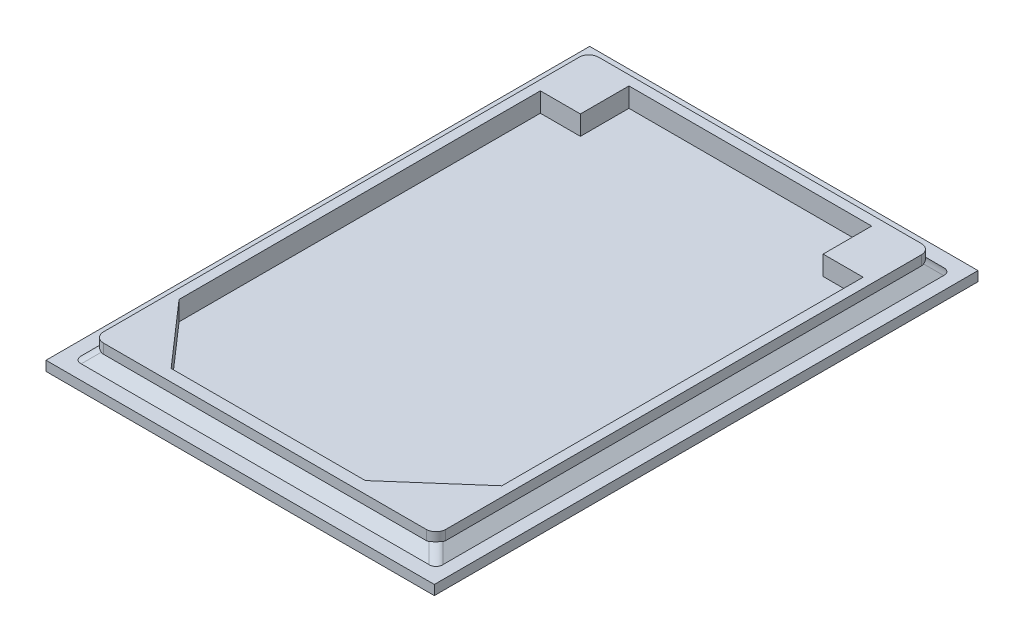
from build123d import *

# Parameters (mm, degrees)
SKETCH_1_W      = 40
SKETCH_1_H      = 56
EXTRUDE_1_DEPTH = 1
SKETCH_2_W      = 35.25
SKETCH_2_H      = 51
EXTRUDE_2_DEPTH = 2
CHAMFER_1_SIZE  = 1
FILLET_1_R      = 1


with BuildPart() as part:
    # Эскиз1 → Бобышка-Вытянуть1 (new body)
    with BuildSketch(Plane(origin=(0, 0, 0), x_dir=(1, 0, 0), z_dir=(0, 1, 0))):
        with Locations((4.960996663, -13.297915159)):
            Rectangle(SKETCH_1_W, SKETCH_1_H)
    extrude(amount=EXTRUDE_1_DEPTH)

    # Эскиз2 → Бобышка-Вытянуть2 (add)
    with BuildSketch(Plane(origin=(0, 1, 0), x_dir=(1, 0, 0), z_dir=(0, 1, 0))):
        with Locations((5.013351172, -13.304787139)):
            Rectangle(SKETCH_2_W, SKETCH_2_H)
        Polygon((-7.486648828, 11.195212861), (17.513351172, 11.195212861), (17.513351172, 6.195212861), (21.638351172, 6.195212861), (21.638351172, -31.019787139), (14.138351172, -37.586749907), (-5.861648828, -37.586749907), (-11.611648828, -31.019787139), (-11.611648828, 6.195212861), (-7.486648828, 6.195212861), align=None, mode=Mode.SUBTRACT)
    extrude(amount=EXTRUDE_2_DEPTH)

    # Фаска1
    chamfer_1_edges = [part.edges().sort_by_distance(p)[0] for p in [
        (-12.611648828, 1, 13.304787139),
        (5.013351172, 1, 38.804787139),
        (22.638351172, 1, 13.304787139),
        (5.013351172, 1, -12.195212861),
    ]]
    chamfer(chamfer_1_edges, length=CHAMFER_1_SIZE)

    # Скругление1
    # the kernel refuses this fillet: 1 mm, written as the material it takes off along each edge
    with BuildSketch(Plane(origin=(-12.611648828, -0.5, -12.195212861), x_dir=(0, 0, 1), z_dir=(0, 1, 0))) as fillet_1_piece_1_section:
        with BuildLine():
            CenterArc((FILLET_1_R, FILLET_1_R), FILLET_1_R, 180, 90)
            Line((0, FILLET_1_R), (0, 0))
            Line((0, 0), (FILLET_1_R, 0))
        make_face()
    fillet_1_piece_1 = extrude(amount=6, mode=Mode.PRIVATE)
    fillet_1_piece_1 = split(fillet_1_piece_1, bisect_by=Plane(origin=(-12.204207693, 2.407441135, -12.152230903), z_dir=(0.7071067811865476, -0.7071067811865476, 0)), keep=Keep.TOP, mode=Mode.PRIVATE)
    fillet_1_piece_1 = split(fillet_1_piece_1, bisect_by=Plane(origin=(-12.0827213, 2.16446835, -12.030744511), z_dir=(0, 0.7071067811865476, -0.7071067811865476)), keep=Keep.TOP, mode=Mode.PRIVATE)
    add(fillet_1_piece_1, mode=Mode.SUBTRACT)
    with BuildSketch(Plane(origin=(-12.611648828, -0.5, -12.195212861), x_dir=(0, 0, 1), z_dir=(0, 1, 0))) as fillet_1_piece_2_section:
        with BuildLine():
            CenterArc((FILLET_1_R, FILLET_1_R), FILLET_1_R, 180, 90)
            Line((0, FILLET_1_R), (0, 0))
            Line((0, 0), (FILLET_1_R, 0))
        make_face()
    fillet_1_piece_2 = extrude(amount=6, mode=Mode.PRIVATE)
    fillet_1_piece_2 = split(fillet_1_piece_2, bisect_by=Plane(origin=(-12.447180477, 2.16446835, -11.666285334), z_dir=(-0.7071067811865476, 0.7071067811865476, 0)), keep=Keep.TOP, mode=Mode.PRIVATE)
    fillet_1_piece_2 = split(fillet_1_piece_2, bisect_by=Plane(origin=(-12.56866687, 2.407441135, -11.787771726), z_dir=(0, -0.7071067811865476, 0.7071067811865476)), keep=Keep.TOP, mode=Mode.PRIVATE)
    add(fillet_1_piece_2, mode=Mode.SUBTRACT)
    with BuildSketch(Plane(origin=(-12.611648828, -0.5, -12.195212861), x_dir=(0, 0, 1), z_dir=(0, 1, 0))) as fillet_1_piece_3_section:
        with BuildLine():
            CenterArc((FILLET_1_R, FILLET_1_R), FILLET_1_R, 180, 90)
            Line((0, FILLET_1_R), (0, 0))
            Line((0, 0), (FILLET_1_R, 0))
        make_face()
    fillet_1_piece_3 = extrude(amount=6, mode=Mode.PRIVATE)
    fillet_1_piece_3 = split(fillet_1_piece_3, bisect_by=Plane(origin=(-11.535111432, 3.076537395, -11.974767382), z_dir=(-0.7071067811865476, 0.7071067811865476, 0)), keep=Keep.TOP, mode=Mode.PRIVATE)
    fillet_1_piece_3 = split(fillet_1_piece_3, bisect_by=Plane(origin=(-12.391203349, 3.076537395, -11.118675466), z_dir=(0, 0.7071067811865476, -0.7071067811865476)), keep=Keep.TOP, mode=Mode.PRIVATE)
    add(fillet_1_piece_3, mode=Mode.SUBTRACT)
    with BuildSketch(Plane(origin=(-12.611648828, -0.5, 38.804787139), x_dir=(0, 0, -1), z_dir=(0, 1, 0))) as fillet_1_piece_4_section:
        with BuildLine():
            CenterArc((FILLET_1_R, -FILLET_1_R), FILLET_1_R, 90, 90)
            Line((0, -FILLET_1_R), (0, 0))
            Line((0, 0), (FILLET_1_R, 0))
        make_face()
    fillet_1_piece_4 = extrude(amount=6, mode=Mode.PRIVATE)
    fillet_1_piece_4 = split(fillet_1_piece_4, bisect_by=Plane(origin=(-12.204207693, 2.407441135, 38.761805181), z_dir=(0.7071067811865476, -0.7071067811865476, 0)), keep=Keep.TOP, mode=Mode.PRIVATE)
    fillet_1_piece_4 = split(fillet_1_piece_4, bisect_by=Plane(origin=(-12.0827213, 2.16446835, 38.640318789), z_dir=(0, 0.7071067811865476, 0.7071067811865476)), keep=Keep.TOP, mode=Mode.PRIVATE)
    add(fillet_1_piece_4, mode=Mode.SUBTRACT)
    with BuildSketch(Plane(origin=(-12.611648828, -0.5, 38.804787139), x_dir=(0, 0, -1), z_dir=(0, 1, 0))) as fillet_1_piece_5_section:
        with BuildLine():
            CenterArc((FILLET_1_R, -FILLET_1_R), FILLET_1_R, 90, 90)
            Line((0, -FILLET_1_R), (0, 0))
            Line((0, 0), (FILLET_1_R, 0))
        make_face()
    fillet_1_piece_5 = extrude(amount=6, mode=Mode.PRIVATE)
    fillet_1_piece_5 = split(fillet_1_piece_5, bisect_by=Plane(origin=(-12.447180477, 2.16446835, 38.275859612), z_dir=(-0.7071067811865476, 0.7071067811865476, 0)), keep=Keep.TOP, mode=Mode.PRIVATE)
    fillet_1_piece_5 = split(fillet_1_piece_5, bisect_by=Plane(origin=(-12.56866687, 2.407441135, 38.397346004), z_dir=(0, -0.7071067811865476, -0.7071067811865476)), keep=Keep.TOP, mode=Mode.PRIVATE)
    add(fillet_1_piece_5, mode=Mode.SUBTRACT)
    with BuildSketch(Plane(origin=(-12.611648828, -0.5, 38.804787139), x_dir=(0, 0, -1), z_dir=(0, 1, 0))) as fillet_1_piece_6_section:
        with BuildLine():
            CenterArc((FILLET_1_R, -FILLET_1_R), FILLET_1_R, 90, 90)
            Line((0, -FILLET_1_R), (0, 0))
            Line((0, 0), (FILLET_1_R, 0))
        make_face()
    fillet_1_piece_6 = extrude(amount=6, mode=Mode.PRIVATE)
    fillet_1_piece_6 = split(fillet_1_piece_6, bisect_by=Plane(origin=(-11.535111432, 3.076537395, 38.58434166), z_dir=(-0.7071067811865476, 0.7071067811865476, 0)), keep=Keep.TOP, mode=Mode.PRIVATE)
    fillet_1_piece_6 = split(fillet_1_piece_6, bisect_by=Plane(origin=(-12.391203349, 3.076537395, 37.728249744), z_dir=(0, 0.7071067811865476, 0.7071067811865476)), keep=Keep.TOP, mode=Mode.PRIVATE)
    add(fillet_1_piece_6, mode=Mode.SUBTRACT)
    with BuildSketch(Plane(origin=(22.638351172, -0.5, 38.804787139), x_dir=(-1, 0, 0), z_dir=(0, 1, 0))) as fillet_1_piece_7_section:
        with BuildLine():
            CenterArc((FILLET_1_R, -FILLET_1_R), FILLET_1_R, 90, 90)
            Line((0, -FILLET_1_R), (0, 0))
            Line((0, 0), (FILLET_1_R, 0))
        make_face()
    fillet_1_piece_7 = extrude(amount=6, mode=Mode.PRIVATE)
    fillet_1_piece_7 = split(fillet_1_piece_7, bisect_by=Plane(origin=(22.595369214, 2.407441135, 38.397346004), z_dir=(0, -0.7071067811865476, -0.7071067811865476)), keep=Keep.TOP, mode=Mode.PRIVATE)
    fillet_1_piece_7 = split(fillet_1_piece_7, bisect_by=Plane(origin=(22.473882822, 2.16446835, 38.275859612), z_dir=(0.7071067811865476, 0.7071067811865476, 0)), keep=Keep.TOP, mode=Mode.PRIVATE)
    add(fillet_1_piece_7, mode=Mode.SUBTRACT)
    with BuildSketch(Plane(origin=(22.638351172, -0.5, 38.804787139), x_dir=(-1, 0, 0), z_dir=(0, 1, 0))) as fillet_1_piece_8_section:
        with BuildLine():
            CenterArc((FILLET_1_R, -FILLET_1_R), FILLET_1_R, 90, 90)
            Line((0, -FILLET_1_R), (0, 0))
            Line((0, 0), (FILLET_1_R, 0))
        make_face()
    fillet_1_piece_8 = extrude(amount=6, mode=Mode.PRIVATE)
    fillet_1_piece_8 = split(fillet_1_piece_8, bisect_by=Plane(origin=(22.109423645, 2.16446835, 38.640318789), z_dir=(0, 0.7071067811865476, 0.7071067811865476)), keep=Keep.TOP, mode=Mode.PRIVATE)
    fillet_1_piece_8 = split(fillet_1_piece_8, bisect_by=Plane(origin=(22.230910038, 2.407441135, 38.761805181), z_dir=(-0.7071067811865476, -0.7071067811865476, 0)), keep=Keep.TOP, mode=Mode.PRIVATE)
    add(fillet_1_piece_8, mode=Mode.SUBTRACT)
    with BuildSketch(Plane(origin=(22.638351172, -0.5, 38.804787139), x_dir=(-1, 0, 0), z_dir=(0, 1, 0))) as fillet_1_piece_9_section:
        with BuildLine():
            CenterArc((FILLET_1_R, -FILLET_1_R), FILLET_1_R, 90, 90)
            Line((0, -FILLET_1_R), (0, 0))
            Line((0, 0), (FILLET_1_R, 0))
        make_face()
    fillet_1_piece_9 = extrude(amount=6, mode=Mode.PRIVATE)
    fillet_1_piece_9 = split(fillet_1_piece_9, bisect_by=Plane(origin=(22.417905694, 3.076537395, 37.728249744), z_dir=(0, 0.7071067811865476, 0.7071067811865476)), keep=Keep.TOP, mode=Mode.PRIVATE)
    fillet_1_piece_9 = split(fillet_1_piece_9, bisect_by=Plane(origin=(21.561813777, 3.076537395, 38.58434166), z_dir=(0.7071067811865476, 0.7071067811865476, 0)), keep=Keep.TOP, mode=Mode.PRIVATE)
    add(fillet_1_piece_9, mode=Mode.SUBTRACT)
    with BuildSketch(Plane(origin=(22.638351172, -0.5, -12.195212861), x_dir=(-1, 0, 0), z_dir=(0, 1, 0))) as fillet_1_piece_10_section:
        with BuildLine():
            CenterArc((FILLET_1_R, FILLET_1_R), FILLET_1_R, 180, 90)
            Line((0, FILLET_1_R), (0, 0))
            Line((0, 0), (FILLET_1_R, 0))
        make_face()
    fillet_1_piece_10 = extrude(amount=6, mode=Mode.PRIVATE)
    fillet_1_piece_10 = split(fillet_1_piece_10, bisect_by=Plane(origin=(22.595369214, 2.407441135, -11.787771726), z_dir=(0, -0.7071067811865476, 0.7071067811865476)), keep=Keep.TOP, mode=Mode.PRIVATE)
    fillet_1_piece_10 = split(fillet_1_piece_10, bisect_by=Plane(origin=(22.473882822, 2.16446835, -11.666285334), z_dir=(0.7071067811865476, 0.7071067811865476, 0)), keep=Keep.TOP, mode=Mode.PRIVATE)
    add(fillet_1_piece_10, mode=Mode.SUBTRACT)
    with BuildSketch(Plane(origin=(22.638351172, -0.5, -12.195212861), x_dir=(-1, 0, 0), z_dir=(0, 1, 0))) as fillet_1_piece_11_section:
        with BuildLine():
            CenterArc((FILLET_1_R, FILLET_1_R), FILLET_1_R, 180, 90)
            Line((0, FILLET_1_R), (0, 0))
            Line((0, 0), (FILLET_1_R, 0))
        make_face()
    fillet_1_piece_11 = extrude(amount=6, mode=Mode.PRIVATE)
    fillet_1_piece_11 = split(fillet_1_piece_11, bisect_by=Plane(origin=(22.109423645, 2.16446835, -12.030744511), z_dir=(0, 0.7071067811865476, -0.7071067811865476)), keep=Keep.TOP, mode=Mode.PRIVATE)
    fillet_1_piece_11 = split(fillet_1_piece_11, bisect_by=Plane(origin=(22.230910038, 2.407441135, -12.152230903), z_dir=(-0.7071067811865476, -0.7071067811865476, 0)), keep=Keep.TOP, mode=Mode.PRIVATE)
    add(fillet_1_piece_11, mode=Mode.SUBTRACT)
    with BuildSketch(Plane(origin=(22.638351172, -0.5, -12.195212861), x_dir=(-1, 0, 0), z_dir=(0, 1, 0))) as fillet_1_piece_12_section:
        with BuildLine():
            CenterArc((FILLET_1_R, FILLET_1_R), FILLET_1_R, 180, 90)
            Line((0, FILLET_1_R), (0, 0))
            Line((0, 0), (FILLET_1_R, 0))
        make_face()
    fillet_1_piece_12 = extrude(amount=6, mode=Mode.PRIVATE)
    fillet_1_piece_12 = split(fillet_1_piece_12, bisect_by=Plane(origin=(22.417905694, 3.076537395, -11.118675466), z_dir=(0, 0.7071067811865476, -0.7071067811865476)), keep=Keep.TOP, mode=Mode.PRIVATE)
    fillet_1_piece_12 = split(fillet_1_piece_12, bisect_by=Plane(origin=(21.561813777, 3.076537395, -11.974767382), z_dir=(0.7071067811865476, 0.7071067811865476, 0)), keep=Keep.TOP, mode=Mode.PRIVATE)
    add(fillet_1_piece_12, mode=Mode.SUBTRACT)
    with BuildSketch(Plane(origin=(24.471684506, 0.166666667, -14.028546194), x_dir=(-0.816496580927726, -0.4082482904638632, -0.40824829046386296), z_dir=(-0.5773502691896258, 0.5773502691896258, 0.5773502691896258))) as fillet_1_piece_13_section:
        with BuildLine():
            CenterArc((FILLET_1_R * 0.57735026919, FILLET_1_R), FILLET_1_R, 210, 60)
            Line((-FILLET_1_R * 0.288675134595, FILLET_1_R * 0.5), (0, 0))
            Line((0, 0), (FILLET_1_R * 0.57735026919, 0))
        make_face()
    fillet_1_piece_13 = extrude(amount=4.618802154, mode=Mode.PRIVATE)
    fillet_1_piece_13 = split(fillet_1_piece_13, bisect_by=Plane(origin=(23.11868341, 1, -12.675545099), z_dir=(0, 1, 0)), keep=Keep.TOP, mode=Mode.PRIVATE)
    fillet_1_piece_13 = split(fillet_1_piece_13, bisect_by=Plane(origin=(23.11868341, 1.382025047, -12.195212861), z_dir=(0, 0, -1)), keep=Keep.TOP, mode=Mode.PRIVATE)
    fillet_1_piece_13 = split(fillet_1_piece_13, bisect_by=Plane(origin=(22.638351172, 1.382025047, -12.675545099), z_dir=(1, 0, 0)), keep=Keep.TOP, mode=Mode.PRIVATE)
    add(fillet_1_piece_13, mode=Mode.SUBTRACT)
    with BuildSketch(Plane(origin=(24.471684506, 0.166666667, -14.028546194), x_dir=(-0.816496580927726, -0.4082482904638632, -0.40824829046386296), z_dir=(-0.5773502691896258, 0.5773502691896258, 0.5773502691896258))) as fillet_1_piece_14_section:
        with BuildLine():
            CenterArc((FILLET_1_R * 0.57735026919, FILLET_1_R), FILLET_1_R, 210, 60)
            Line((-FILLET_1_R * 0.288675134595, FILLET_1_R * 0.5), (0, 0))
            Line((0, 0), (FILLET_1_R * 0.57735026919, 0))
        make_face()
    fillet_1_piece_14 = extrude(amount=4.618802154, mode=Mode.PRIVATE)
    fillet_1_piece_14 = split(fillet_1_piece_14, bisect_by=Plane(origin=(22.825799609, 1.79813974, -12.195212861), z_dir=(0, 0, 1)), keep=Keep.TOP, mode=Mode.PRIVATE)
    fillet_1_piece_14 = split(fillet_1_piece_14, bisect_by=Plane(origin=(22.638351172, 1.79813974, -12.007764424), z_dir=(1, 0, 0)), keep=Keep.TOP, mode=Mode.PRIVATE)
    add(fillet_1_piece_14, mode=Mode.SUBTRACT)
    with BuildSketch(Plane(origin=(24.471684506, 0.166666667, -14.028546194), x_dir=(-0.816496580927726, -0.4082482904638632, -0.40824829046386296), z_dir=(-0.5773502691896258, 0.5773502691896258, 0.5773502691896258))) as fillet_1_piece_15_section:
        with BuildLine():
            CenterArc((FILLET_1_R * 0.57735026919, FILLET_1_R), FILLET_1_R, 210, 60)
            Line((-FILLET_1_R * 0.288675134595, FILLET_1_R * 0.5), (0, 0))
            Line((0, 0), (FILLET_1_R * 0.57735026919, 0))
        make_face()
    fillet_1_piece_15 = extrude(amount=4.618802154, mode=Mode.PRIVATE)
    fillet_1_piece_15 = split(fillet_1_piece_15, bisect_by=Plane(origin=(22.450902736, 1.79813974, -12.195212861), z_dir=(0, 0, -1)), keep=Keep.TOP, mode=Mode.PRIVATE)
    fillet_1_piece_15 = split(fillet_1_piece_15, bisect_by=Plane(origin=(22.638351172, 1.79813974, -12.382661298), z_dir=(-1, 0, 0)), keep=Keep.TOP, mode=Mode.PRIVATE)
    add(fillet_1_piece_15, mode=Mode.SUBTRACT)
    with BuildSketch(Plane(origin=(24.471684506, 0.166666667, 40.638120472), x_dir=(-0.816496580927726, -0.40824829046385686, 0.4082482904638692), z_dir=(-0.5773502691896258, 0.5773502691896258, -0.5773502691896258))) as fillet_1_piece_16_section:
        with BuildLine():
            CenterArc((FILLET_1_R * 0.57735026919, -FILLET_1_R), FILLET_1_R, 90, 60)
            Line((-FILLET_1_R * 0.288675134595, -FILLET_1_R * 0.5), (0, 0))
            Line((0, 0), (FILLET_1_R * 0.57735026919, 0))
        make_face()
    fillet_1_piece_16 = extrude(amount=4.618802154, mode=Mode.PRIVATE)
    fillet_1_piece_16 = split(fillet_1_piece_16, bisect_by=Plane(origin=(23.11868341, 1, 39.285119377), z_dir=(0, 1, 0)), keep=Keep.TOP, mode=Mode.PRIVATE)
    fillet_1_piece_16 = split(fillet_1_piece_16, bisect_by=Plane(origin=(23.11868341, 1.382025047, 38.804787139), z_dir=(0, 0, 1)), keep=Keep.TOP, mode=Mode.PRIVATE)
    fillet_1_piece_16 = split(fillet_1_piece_16, bisect_by=Plane(origin=(22.638351172, 1.382025047, 39.285119377), z_dir=(1, 0, 0)), keep=Keep.TOP, mode=Mode.PRIVATE)
    add(fillet_1_piece_16, mode=Mode.SUBTRACT)
    with BuildSketch(Plane(origin=(24.471684506, 0.166666667, 40.638120472), x_dir=(-0.816496580927726, -0.40824829046385686, 0.4082482904638692), z_dir=(-0.5773502691896258, 0.5773502691896258, -0.5773502691896258))) as fillet_1_piece_17_section:
        with BuildLine():
            CenterArc((FILLET_1_R * 0.57735026919, -FILLET_1_R), FILLET_1_R, 90, 60)
            Line((-FILLET_1_R * 0.288675134595, -FILLET_1_R * 0.5), (0, 0))
            Line((0, 0), (FILLET_1_R * 0.57735026919, 0))
        make_face()
    fillet_1_piece_17 = extrude(amount=4.618802154, mode=Mode.PRIVATE)
    fillet_1_piece_17 = split(fillet_1_piece_17, bisect_by=Plane(origin=(22.825799609, 1.79813974, 38.804787139), z_dir=(0, 0, -1)), keep=Keep.TOP, mode=Mode.PRIVATE)
    fillet_1_piece_17 = split(fillet_1_piece_17, bisect_by=Plane(origin=(22.638351172, 1.79813974, 38.617338702), z_dir=(1, 0, 0)), keep=Keep.TOP, mode=Mode.PRIVATE)
    add(fillet_1_piece_17, mode=Mode.SUBTRACT)
    with BuildSketch(Plane(origin=(24.471684506, 0.166666667, 40.638120472), x_dir=(-0.816496580927726, -0.40824829046385686, 0.4082482904638692), z_dir=(-0.5773502691896258, 0.5773502691896258, -0.5773502691896258))) as fillet_1_piece_18_section:
        with BuildLine():
            CenterArc((FILLET_1_R * 0.57735026919, -FILLET_1_R), FILLET_1_R, 90, 60)
            Line((-FILLET_1_R * 0.288675134595, -FILLET_1_R * 0.5), (0, 0))
            Line((0, 0), (FILLET_1_R * 0.57735026919, 0))
        make_face()
    fillet_1_piece_18 = extrude(amount=4.618802154, mode=Mode.PRIVATE)
    fillet_1_piece_18 = split(fillet_1_piece_18, bisect_by=Plane(origin=(22.450902736, 1.79813974, 38.804787139), z_dir=(0, 0, 1)), keep=Keep.TOP, mode=Mode.PRIVATE)
    fillet_1_piece_18 = split(fillet_1_piece_18, bisect_by=Plane(origin=(22.638351172, 1.79813974, 38.992235576), z_dir=(-1, 0, 0)), keep=Keep.TOP, mode=Mode.PRIVATE)
    add(fillet_1_piece_18, mode=Mode.SUBTRACT)
    with BuildSketch(Plane(origin=(-14.444982161, 0.166666667, -14.028546194), x_dir=(-0.40824829046386274, -0.40824829046386335, 0.8164965809277261), z_dir=(0.5773502691896258, 0.5773502691896258, 0.5773502691896258))) as fillet_1_piece_19_section:
        with BuildLine():
            CenterArc((FILLET_1_R * 0.57735026919, FILLET_1_R), FILLET_1_R, 210, 60)
            Line((-FILLET_1_R * 0.288675134595, FILLET_1_R * 0.5), (0, 0))
            Line((0, 0), (FILLET_1_R * 0.57735026919, 0))
        make_face()
    fillet_1_piece_19 = extrude(amount=4.618802154, mode=Mode.PRIVATE)
    fillet_1_piece_19 = split(fillet_1_piece_19, bisect_by=Plane(origin=(-13.091981065, 1, -12.675545099), z_dir=(0, 1, 0)), keep=Keep.TOP, mode=Mode.PRIVATE)
    fillet_1_piece_19 = split(fillet_1_piece_19, bisect_by=Plane(origin=(-12.611648828, 1.382025047, -12.675545099), z_dir=(-1, 0, 0)), keep=Keep.TOP, mode=Mode.PRIVATE)
    fillet_1_piece_19 = split(fillet_1_piece_19, bisect_by=Plane(origin=(-13.091981065, 1.382025047, -12.195212861), z_dir=(0, 0, -1)), keep=Keep.TOP, mode=Mode.PRIVATE)
    add(fillet_1_piece_19, mode=Mode.SUBTRACT)
    with BuildSketch(Plane(origin=(-14.444982161, 0.166666667, -14.028546194), x_dir=(-0.40824829046386274, -0.40824829046386335, 0.8164965809277261), z_dir=(0.5773502691896258, 0.5773502691896258, 0.5773502691896258))) as fillet_1_piece_20_section:
        with BuildLine():
            CenterArc((FILLET_1_R * 0.57735026919, FILLET_1_R), FILLET_1_R, 210, 60)
            Line((-FILLET_1_R * 0.288675134595, FILLET_1_R * 0.5), (0, 0))
            Line((0, 0), (FILLET_1_R * 0.57735026919, 0))
        make_face()
    fillet_1_piece_20 = extrude(amount=4.618802154, mode=Mode.PRIVATE)
    fillet_1_piece_20 = split(fillet_1_piece_20, bisect_by=Plane(origin=(-12.611648828, 1.79813974, -12.382661298), z_dir=(1, 0, 0)), keep=Keep.TOP, mode=Mode.PRIVATE)
    fillet_1_piece_20 = split(fillet_1_piece_20, bisect_by=Plane(origin=(-12.424200391, 1.79813974, -12.195212861), z_dir=(0, 0, -1)), keep=Keep.TOP, mode=Mode.PRIVATE)
    add(fillet_1_piece_20, mode=Mode.SUBTRACT)
    with BuildSketch(Plane(origin=(-14.444982161, 0.166666667, -14.028546194), x_dir=(-0.40824829046386274, -0.40824829046386335, 0.8164965809277261), z_dir=(0.5773502691896258, 0.5773502691896258, 0.5773502691896258))) as fillet_1_piece_21_section:
        with BuildLine():
            CenterArc((FILLET_1_R * 0.57735026919, FILLET_1_R), FILLET_1_R, 210, 60)
            Line((-FILLET_1_R * 0.288675134595, FILLET_1_R * 0.5), (0, 0))
            Line((0, 0), (FILLET_1_R * 0.57735026919, 0))
        make_face()
    fillet_1_piece_21 = extrude(amount=4.618802154, mode=Mode.PRIVATE)
    fillet_1_piece_21 = split(fillet_1_piece_21, bisect_by=Plane(origin=(-12.611648828, 1.79813974, -12.007764424), z_dir=(-1, 0, 0)), keep=Keep.TOP, mode=Mode.PRIVATE)
    fillet_1_piece_21 = split(fillet_1_piece_21, bisect_by=Plane(origin=(-12.799097264, 1.79813974, -12.195212861), z_dir=(0, 0, 1)), keep=Keep.TOP, mode=Mode.PRIVATE)
    add(fillet_1_piece_21, mode=Mode.SUBTRACT)
    with BuildSketch(Plane(origin=(-14.444982161, 0.166666667, 40.638120472), x_dir=(-0.4082482904638619, -0.408248290463864, -0.816496580927726), z_dir=(0.5773502691896258, 0.5773502691896258, -0.5773502691896258))) as fillet_1_piece_22_section:
        with BuildLine():
            CenterArc((FILLET_1_R * 0.57735026919, -FILLET_1_R), FILLET_1_R, 90, 60)
            Line((-FILLET_1_R * 0.288675134595, -FILLET_1_R * 0.5), (0, 0))
            Line((0, 0), (FILLET_1_R * 0.57735026919, 0))
        make_face()
    fillet_1_piece_22 = extrude(amount=4.618802154, mode=Mode.PRIVATE)
    fillet_1_piece_22 = split(fillet_1_piece_22, bisect_by=Plane(origin=(-13.091981065, 1, 39.285119377), z_dir=(0, 1, 0)), keep=Keep.TOP, mode=Mode.PRIVATE)
    fillet_1_piece_22 = split(fillet_1_piece_22, bisect_by=Plane(origin=(-12.611648828, 1.382025047, 39.285119377), z_dir=(-1, 0, 0)), keep=Keep.TOP, mode=Mode.PRIVATE)
    fillet_1_piece_22 = split(fillet_1_piece_22, bisect_by=Plane(origin=(-13.091981065, 1.382025047, 38.804787139), z_dir=(0, 0, 1)), keep=Keep.TOP, mode=Mode.PRIVATE)
    add(fillet_1_piece_22, mode=Mode.SUBTRACT)
    with BuildSketch(Plane(origin=(-14.444982161, 0.166666667, 40.638120472), x_dir=(-0.4082482904638619, -0.408248290463864, -0.816496580927726), z_dir=(0.5773502691896258, 0.5773502691896258, -0.5773502691896258))) as fillet_1_piece_23_section:
        with BuildLine():
            CenterArc((FILLET_1_R * 0.57735026919, -FILLET_1_R), FILLET_1_R, 90, 60)
            Line((-FILLET_1_R * 0.288675134595, -FILLET_1_R * 0.5), (0, 0))
            Line((0, 0), (FILLET_1_R * 0.57735026919, 0))
        make_face()
    fillet_1_piece_23 = extrude(amount=4.618802154, mode=Mode.PRIVATE)
    fillet_1_piece_23 = split(fillet_1_piece_23, bisect_by=Plane(origin=(-12.611648828, 1.79813974, 38.992235576), z_dir=(1, 0, 0)), keep=Keep.TOP, mode=Mode.PRIVATE)
    fillet_1_piece_23 = split(fillet_1_piece_23, bisect_by=Plane(origin=(-12.424200391, 1.79813974, 38.804787139), z_dir=(0, 0, 1)), keep=Keep.TOP, mode=Mode.PRIVATE)
    add(fillet_1_piece_23, mode=Mode.SUBTRACT)
    with BuildSketch(Plane(origin=(-14.444982161, 0.166666667, 40.638120472), x_dir=(-0.4082482904638619, -0.408248290463864, -0.816496580927726), z_dir=(0.5773502691896258, 0.5773502691896258, -0.5773502691896258))) as fillet_1_piece_24_section:
        with BuildLine():
            CenterArc((FILLET_1_R * 0.57735026919, -FILLET_1_R), FILLET_1_R, 90, 60)
            Line((-FILLET_1_R * 0.288675134595, -FILLET_1_R * 0.5), (0, 0))
            Line((0, 0), (FILLET_1_R * 0.57735026919, 0))
        make_face()
    fillet_1_piece_24 = extrude(amount=4.618802154, mode=Mode.PRIVATE)
    fillet_1_piece_24 = split(fillet_1_piece_24, bisect_by=Plane(origin=(-12.611648828, 1.79813974, 38.617338702), z_dir=(-1, 0, 0)), keep=Keep.TOP, mode=Mode.PRIVATE)
    fillet_1_piece_24 = split(fillet_1_piece_24, bisect_by=Plane(origin=(-12.799097264, 1.79813974, 38.804787139), z_dir=(0, 0, -1)), keep=Keep.TOP, mode=Mode.PRIVATE)
    add(fillet_1_piece_24, mode=Mode.SUBTRACT)
    with BuildSketch(Plane(origin=(-14.444982161, 0.166666667, -14.028546194), x_dir=(-0.40824829046386274, -0.40824829046386335, 0.8164965809277261), z_dir=(0.5773502691896258, 0.5773502691896258, 0.5773502691896258))) as fillet_1_piece_25a_section:
        with BuildLine():
            CenterArc((FILLET_1_R * 0.57735026919, FILLET_1_R), FILLET_1_R, 210, 60)
            Line((-FILLET_1_R * 0.288675134595, FILLET_1_R * 0.5), (0, 0))
            Line((0, 0), (FILLET_1_R * 0.57735026919, 0))
        make_face()
    fillet_1_piece_25a = extrude(amount=4.618802154, mode=Mode.PRIVATE)
    fillet_1_piece_25a = split(fillet_1_piece_25a, bisect_by=Plane(origin=(-12.611648828, 2.347749558, -11.699257601), z_dir=(1, 0, 0)), keep=Keep.TOP, mode=Mode.PRIVATE)
    fillet_1_piece_25a = split(fillet_1_piece_25a, bisect_by=Plane(origin=(-12.115693568, 2.347749558, -12.195212861), z_dir=(0, 0, 1)), keep=Keep.TOP, mode=Mode.PRIVATE)
    with BuildSketch(Plane(origin=(-12.611648828, -0.5, -12.195212861), x_dir=(0, 0, 1), z_dir=(0, 1, 0))) as fillet_1_piece_25b_section:
        with BuildLine():
            CenterArc((FILLET_1_R, FILLET_1_R), FILLET_1_R, 180, 90)
            Line((0, FILLET_1_R), (0, 0))
            Line((0, 0), (FILLET_1_R, 0))
        make_face()
    fillet_1_piece_25b = extrude(amount=6, mode=Mode.PRIVATE)
    fillet_1_piece_25b = split(fillet_1_piece_25b, bisect_by=Plane(origin=(-13.104295651, 1.507353177, -11.968643573), z_dir=(0.7071067811865476, -0.7071067811865476, 0)), keep=Keep.TOP, mode=Mode.PRIVATE)
    fillet_1_piece_25b = split(fillet_1_piece_25b, bisect_by=Plane(origin=(-12.38507954, 1.507353177, -12.687859684), z_dir=(0, -0.7071067811865476, 0.7071067811865476)), keep=Keep.TOP, mode=Mode.PRIVATE)
    fillet_1_piece_25 = fillet_1_piece_25a & fillet_1_piece_25b
    add(fillet_1_piece_25, mode=Mode.SUBTRACT)
    with BuildSketch(Plane(origin=(-14.444982161, 0.166666667, 40.638120472), x_dir=(-0.4082482904638619, -0.408248290463864, -0.816496580927726), z_dir=(0.5773502691896258, 0.5773502691896258, -0.5773502691896258))) as fillet_1_piece_26a_section:
        with BuildLine():
            CenterArc((FILLET_1_R * 0.57735026919, -FILLET_1_R), FILLET_1_R, 90, 60)
            Line((-FILLET_1_R * 0.288675134595, -FILLET_1_R * 0.5), (0, 0))
            Line((0, 0), (FILLET_1_R * 0.57735026919, 0))
        make_face()
    fillet_1_piece_26a = extrude(amount=4.618802154, mode=Mode.PRIVATE)
    fillet_1_piece_26a = split(fillet_1_piece_26a, bisect_by=Plane(origin=(-12.611648828, 2.347749558, 38.308831879), z_dir=(1, 0, 0)), keep=Keep.TOP, mode=Mode.PRIVATE)
    fillet_1_piece_26a = split(fillet_1_piece_26a, bisect_by=Plane(origin=(-12.115693568, 2.347749558, 38.804787139), z_dir=(0, 0, -1)), keep=Keep.TOP, mode=Mode.PRIVATE)
    with BuildSketch(Plane(origin=(-12.611648828, -0.5, 38.804787139), x_dir=(0, 0, -1), z_dir=(0, 1, 0))) as fillet_1_piece_26b_section:
        with BuildLine():
            CenterArc((FILLET_1_R, -FILLET_1_R), FILLET_1_R, 90, 90)
            Line((0, -FILLET_1_R), (0, 0))
            Line((0, 0), (FILLET_1_R, 0))
        make_face()
    fillet_1_piece_26b = extrude(amount=6, mode=Mode.PRIVATE)
    fillet_1_piece_26b = split(fillet_1_piece_26b, bisect_by=Plane(origin=(-13.104295651, 1.507353177, 38.578217851), z_dir=(0.7071067811865476, -0.7071067811865476, 0)), keep=Keep.TOP, mode=Mode.PRIVATE)
    fillet_1_piece_26b = split(fillet_1_piece_26b, bisect_by=Plane(origin=(-12.38507954, 1.507353177, 39.297433962), z_dir=(0, -0.7071067811865476, -0.7071067811865476)), keep=Keep.TOP, mode=Mode.PRIVATE)
    fillet_1_piece_26 = fillet_1_piece_26a & fillet_1_piece_26b
    add(fillet_1_piece_26, mode=Mode.SUBTRACT)
    with BuildSketch(Plane(origin=(24.471684506, 0.166666667, 40.638120472), x_dir=(-0.816496580927726, -0.40824829046385686, 0.4082482904638692), z_dir=(-0.5773502691896258, 0.5773502691896258, -0.5773502691896258))) as fillet_1_piece_27a_section:
        with BuildLine():
            CenterArc((FILLET_1_R * 0.57735026919, -FILLET_1_R), FILLET_1_R, 90, 60)
            Line((-FILLET_1_R * 0.288675134595, -FILLET_1_R * 0.5), (0, 0))
            Line((0, 0), (FILLET_1_R * 0.57735026919, 0))
        make_face()
    fillet_1_piece_27a = extrude(amount=4.618802154, mode=Mode.PRIVATE)
    fillet_1_piece_27a = split(fillet_1_piece_27a, bisect_by=Plane(origin=(22.142395913, 2.347749558, 38.804787139), z_dir=(0, 0, -1)), keep=Keep.TOP, mode=Mode.PRIVATE)
    fillet_1_piece_27a = split(fillet_1_piece_27a, bisect_by=Plane(origin=(22.638351172, 2.347749558, 38.308831879), z_dir=(-1, 0, 0)), keep=Keep.TOP, mode=Mode.PRIVATE)
    with BuildSketch(Plane(origin=(22.638351172, -0.5, 38.804787139), x_dir=(-1, 0, 0), z_dir=(0, 1, 0))) as fillet_1_piece_27b_section:
        with BuildLine():
            CenterArc((FILLET_1_R, -FILLET_1_R), FILLET_1_R, 90, 90)
            Line((0, -FILLET_1_R), (0, 0))
            Line((0, 0), (FILLET_1_R, 0))
        make_face()
    fillet_1_piece_27b = extrude(amount=6, mode=Mode.PRIVATE)
    fillet_1_piece_27b = split(fillet_1_piece_27b, bisect_by=Plane(origin=(22.411781885, 1.507353177, 39.297433962), z_dir=(0, -0.7071067811865476, -0.7071067811865476)), keep=Keep.TOP, mode=Mode.PRIVATE)
    fillet_1_piece_27b = split(fillet_1_piece_27b, bisect_by=Plane(origin=(23.130997996, 1.507353177, 38.578217851), z_dir=(-0.7071067811865476, -0.7071067811865476, 0)), keep=Keep.TOP, mode=Mode.PRIVATE)
    fillet_1_piece_27 = fillet_1_piece_27a & fillet_1_piece_27b
    add(fillet_1_piece_27, mode=Mode.SUBTRACT)
    with BuildSketch(Plane(origin=(24.471684506, 0.166666667, -14.028546194), x_dir=(-0.816496580927726, -0.4082482904638632, -0.40824829046386296), z_dir=(-0.5773502691896258, 0.5773502691896258, 0.5773502691896258))) as fillet_1_piece_28a_section:
        with BuildLine():
            CenterArc((FILLET_1_R * 0.57735026919, FILLET_1_R), FILLET_1_R, 210, 60)
            Line((-FILLET_1_R * 0.288675134595, FILLET_1_R * 0.5), (0, 0))
            Line((0, 0), (FILLET_1_R * 0.57735026919, 0))
        make_face()
    fillet_1_piece_28a = extrude(amount=4.618802154, mode=Mode.PRIVATE)
    fillet_1_piece_28a = split(fillet_1_piece_28a, bisect_by=Plane(origin=(22.142395913, 2.347749558, -12.195212861), z_dir=(0, 0, 1)), keep=Keep.TOP, mode=Mode.PRIVATE)
    fillet_1_piece_28a = split(fillet_1_piece_28a, bisect_by=Plane(origin=(22.638351172, 2.347749558, -11.699257601), z_dir=(-1, 0, 0)), keep=Keep.TOP, mode=Mode.PRIVATE)
    with BuildSketch(Plane(origin=(22.638351172, -0.5, -12.195212861), x_dir=(-1, 0, 0), z_dir=(0, 1, 0))) as fillet_1_piece_28b_section:
        with BuildLine():
            CenterArc((FILLET_1_R, FILLET_1_R), FILLET_1_R, 180, 90)
            Line((0, FILLET_1_R), (0, 0))
            Line((0, 0), (FILLET_1_R, 0))
        make_face()
    fillet_1_piece_28b = extrude(amount=6, mode=Mode.PRIVATE)
    fillet_1_piece_28b = split(fillet_1_piece_28b, bisect_by=Plane(origin=(22.411781885, 1.507353177, -12.687859684), z_dir=(0, -0.7071067811865476, 0.7071067811865476)), keep=Keep.TOP, mode=Mode.PRIVATE)
    fillet_1_piece_28b = split(fillet_1_piece_28b, bisect_by=Plane(origin=(23.130997996, 1.507353177, -11.968643573), z_dir=(-0.7071067811865476, -0.7071067811865476, 0)), keep=Keep.TOP, mode=Mode.PRIVATE)
    fillet_1_piece_28 = fillet_1_piece_28a & fillet_1_piece_28b
    add(fillet_1_piece_28, mode=Mode.SUBTRACT)


solid = part.part
